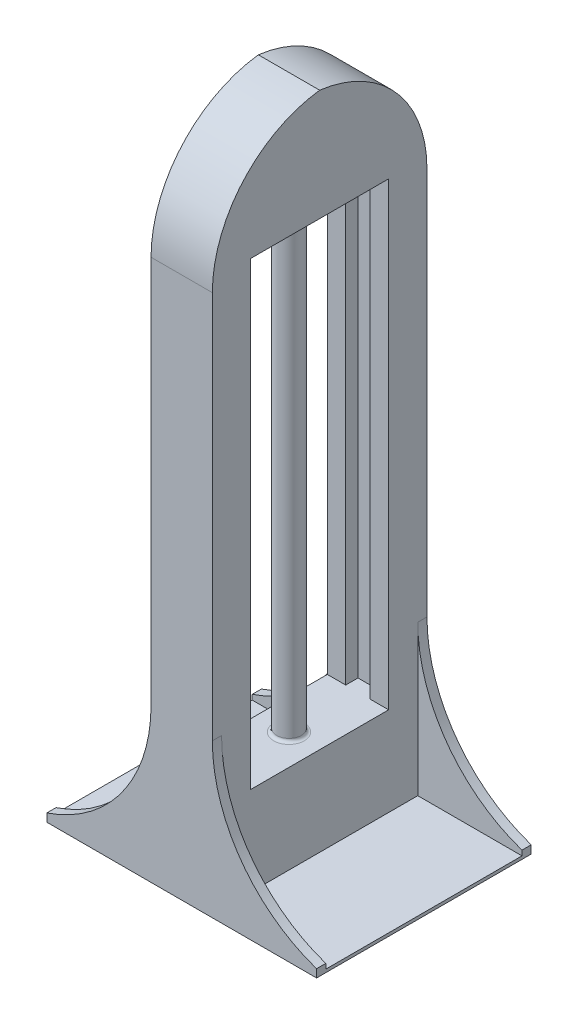
from build123d import *

# Parameters (mm, degrees)
AUFSATZ_LINEAR_AUSTRAGEN1_DEPTH             = 350
AUFSATZ_LINEAR_AUSTRAGEN1_DEPTH_BACK        = 350
SKIZZE1_W                                   = 200
SKIZZE1_H                                   = 2166
VERRUNDUNG1_R                               = 400
SKIZZE2_W                                   = 450
SKIZZE2_H                                   = 1500
SCHNITT_LINEAR_AUSTRAGEN1_DEPTH             = 200
SKIZZE4_W                                   = 80
SKIZZE4_H                                   = 1500
SCHNITT_LINEAR_AUSTRAGEN2_DEPTH             = 40
SKIZZE5_R                                   = 40
AUFSATZ_LINEAR_AUSTRAGEN2_DEPTH             = 1500
VERRUNDUNG2_R                               = 10
SKIZZE6_W                                   = 30
SKIZZE6_H                                   = 500
AUFSATZ_LINEAR_AUSTRAGEN3_DEPTH             = 500
SKIZZE7_W                                   = 1200
SKIZZE7_H                                   = 700
AUFSATZ_LINEAR_AUSTRAGEN4_DEPTH             = 10
SCHNITT_LINEAR_AUSTRAGEN3_DEPTH             = 2352.164614527
SCHNITT_LINEAR_AUSTRAGEN4_REACH             = 2264.149
SKIZZE10_W                                  = 160
SKIZZE10_H                                  = 700
SCHNITT_LINEAR_AUSTRAGEN4_DIRECTION_2_DEPTH = 2263.148932027


with BuildPart() as part:
    # Skizze1 → Aufsatz-Linear austragen1 (new, two sides: drawn at the far end of the back side and taken through both)
    with BuildSketch(Plane.XY.offset(-AUFSATZ_LINEAR_AUSTRAGEN1_DEPTH_BACK)):
        with Locations((0, 1083)):
            Rectangle(SKIZZE1_W, SKIZZE1_H)
    extrude(amount=AUFSATZ_LINEAR_AUSTRAGEN1_DEPTH + AUFSATZ_LINEAR_AUSTRAGEN1_DEPTH_BACK)

    # Verrundung1
    # the kernel refuses this fillet: 400 mm, written as the material it takes off along each edge
    with BuildSketch(Plane(origin=(1100, 2166, -350), x_dir=(0, -1, 0), z_dir=(-1, 0, 0)), Plane(origin=(1100, 2166, 350), x_dir=(0, 0, -1), z_dir=(-1, 0, 0))) as verrundung1_piece_1:
        with BuildLine():
            CenterArc((VERRUNDUNG1_R, VERRUNDUNG1_R), VERRUNDUNG1_R, 180, 90)
            Line((0, VERRUNDUNG1_R), (0, 0))
            Line((0, 0), (VERRUNDUNG1_R, 0))
        make_face()
    extrude(amount=2200, mode=Mode.SUBTRACT)

    # Skizze2 → Schnitt-Linear austragen1 (cut)
    with BuildSketch(Plane(origin=(100, 0, 0), x_dir=(0, 0, -1), z_dir=(1, 0, 0))):
        with Locations((0, 1050)):
            Rectangle(SKIZZE2_W, SKIZZE2_H)
    extrude(amount=-SCHNITT_LINEAR_AUSTRAGEN1_DEPTH, mode=Mode.SUBTRACT)

    # Skizze4 → Schnitt-Linear austragen2 (cut)
    with BuildSketch(Plane.XY.offset(-225)):
        with Locations((0, 1050)):
            Rectangle(SKIZZE4_W, SKIZZE4_H)
    schnitt_linear_austragen2 = extrude(amount=-SCHNITT_LINEAR_AUSTRAGEN2_DEPTH, mode=Mode.SUBTRACT)

    # Spiegeln1: Schnitt-Linear austragen2 across plane
    add(schnitt_linear_austragen2.mirror(Plane.XY), mode=Mode.SUBTRACT)

    # Skizze5 → Aufsatz-Linear austragen2 (add)
    with BuildSketch(Plane(origin=(0, 300, 0), x_dir=(1, 0, 0), z_dir=(0, 1, 0))):
        with Locations(Location((0, 0, 0), (0, 0, 90))):
            Circle(SKIZZE5_R)
    extrude(amount=AUFSATZ_LINEAR_AUSTRAGEN2_DEPTH)

    # Verrundung2
    verrundung2_edges = [part.edges().sort_by_distance(p)[0] for p in [
        (0, 300, 40),
        (0, 1800, 40),
    ]]
    fillet(verrundung2_edges, radius=VERRUNDUNG2_R)

    # Skizze6 → Aufsatz-Linear austragen3 (add)
    with BuildSketch(Plane(origin=(100, 0, 0), x_dir=(0, 0, -1), z_dir=(1, 0, 0))):
        with Locations((-335, 250)):
            Rectangle(SKIZZE6_W, SKIZZE6_H)
        with Locations((335, 250)):
            Rectangle(SKIZZE6_W, SKIZZE6_H)
    aufsatz_linear_austragen3 = extrude(amount=AUFSATZ_LINEAR_AUSTRAGEN3_DEPTH)

    # Spiegeln2: Aufsatz-Linear austragen3 across plane
    add(aufsatz_linear_austragen3.mirror(Plane(origin=(0, 0, 0), x_dir=(0, 0, 1), z_dir=(1, 0, 0))))

    # Skizze7 → Aufsatz-Linear austragen4 (add)
    with BuildSketch(Plane.XZ):
        Rectangle(SKIZZE7_W, SKIZZE7_H)
    extrude(amount=-AUFSATZ_LINEAR_AUSTRAGEN4_DEPTH)

    # Skizze9 → Schnitt-Linear austragen3 (cut, symmetric)
    with BuildSketch(Plane.XY.offset(350)):
        with BuildLine():
            Line((100, 5456.908143316), (100, 500))
            ThreePointArc((100, 500), (246.446609407, 146.446609407), (600, 0))
            Line((600, 0), (5556.908143316, 0))
            Line((5556.908143316, 0), (12567.034867032, 7010.126723715))
            Line((12567.034867032, 7010.126723715), (7110.126723715, 12467.034867032))
            Line((7110.126723715, 12467.034867032), (100, 5456.908143316))
        make_face()
    schnitt_linear_austragen3 = extrude(amount=SCHNITT_LINEAR_AUSTRAGEN3_DEPTH, both=True, mode=Mode.SUBTRACT)

    # Spiegeln3: Schnitt-Linear austragen3 across plane
    add(schnitt_linear_austragen3.mirror(Plane(origin=(0, 0, 0), x_dir=(0, 0, 1), z_dir=(1, 0, 0))), mode=Mode.SUBTRACT)

    # Schnitt-Linear austragen4: up to this face of the body (flat: up to its plane)
    schnitt_linear_austragen4_end = Plane(part.part.faces().sort_by_distance((0, 0, 0))[0])
    # Skizze10 → Schnitt-Linear austragen4 (cut, up to the picked face)
    with BuildSketch(Plane(origin=(0, 10, 0), x_dir=(1, 0, 0), z_dir=(0, 1, 0)), mode=Mode.PRIVATE) as schnitt_linear_austragen4_sk1:
        with Locations((520, 0)):
            Rectangle(SKIZZE10_W, SKIZZE10_H)
    schnitt_linear_austragen4_tool1 = split(extrude(schnitt_linear_austragen4_sk1.sketch, amount=-SCHNITT_LINEAR_AUSTRAGEN4_REACH, mode=Mode.PRIVATE), bisect_by=schnitt_linear_austragen4_end, keep=Keep.BOTH, mode=Mode.PRIVATE)
    schnitt_linear_austragen4 = schnitt_linear_austragen4_tool1.solids().sort_by(Axis((520, 10, 0), (0, -1, 0)))[0]
    add(schnitt_linear_austragen4, mode=Mode.SUBTRACT)

    # Skizze10 → Schnitt-Linear austragen4 direction 2 (cut)
    with BuildSketch(Plane(origin=(0, 10, 0), x_dir=(1, 0, 0), z_dir=(0, 1, 0))):
        with Locations((520, 0)):
            Rectangle(SKIZZE10_W, SKIZZE10_H)
    schnitt_linear_austragen4_direction_2 = extrude(amount=SCHNITT_LINEAR_AUSTRAGEN4_DIRECTION_2_DEPTH, mode=Mode.SUBTRACT)

    # Spiegeln4: Schnitt-Linear austragen4, Schnitt-Linear austragen4 direction 2 across plane
    add(schnitt_linear_austragen4.mirror(Plane(origin=(0, 0, 0), x_dir=(0, 0, 1), z_dir=(1, 0, 0))), mode=Mode.SUBTRACT)
    add(schnitt_linear_austragen4_direction_2.mirror(Plane(origin=(0, 0, 0), x_dir=(0, 0, 1), z_dir=(1, 0, 0))), mode=Mode.SUBTRACT)


solid = part.part
